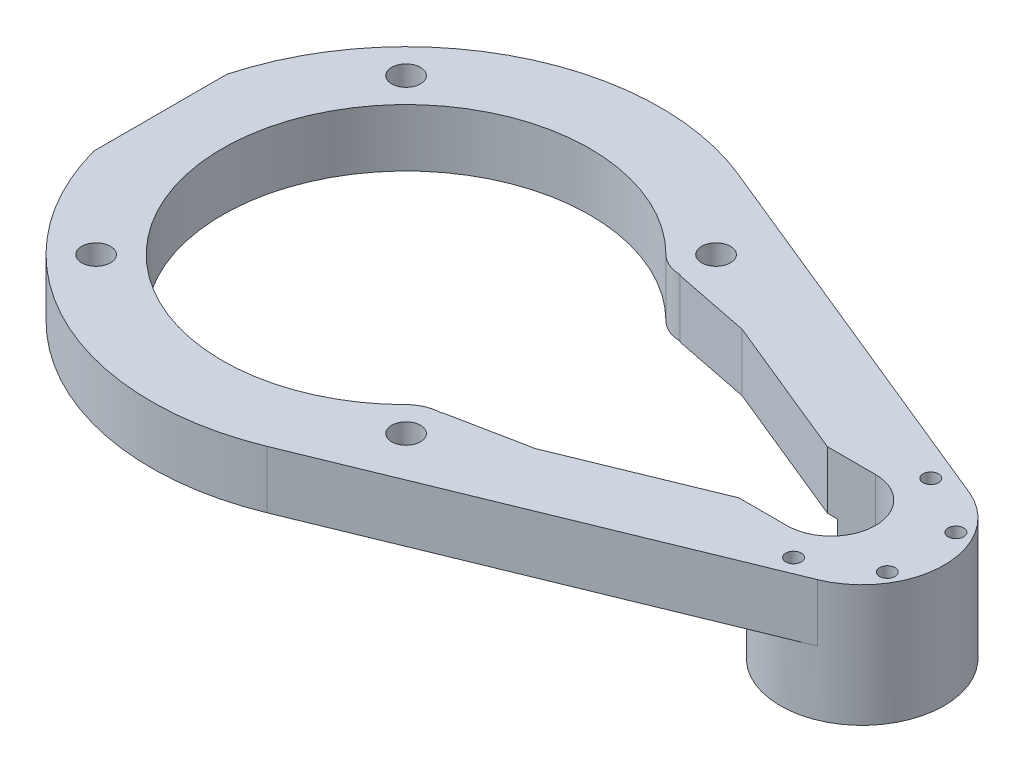
from build123d import *

# Parameters (mm, degrees)
SKETCH1_R           = 3.25
BOSS_EXTRUDE1_DEPTH = 13
BOSS_EXTRUDE2_START = -14.5
BOSS_EXTRUDE2_DEPTH = 14.5
CUT_EXTRUDE1_REACH  = 139.202
SKETCH3_R           = 1.75
SKETCH4_R           = 3.25
CUT_EXTRUDE2_DEPTH  = 1.2


with BuildPart() as part:
    # Sketch1 → Boss-Extrude1 (new body)
    with BuildSketch(Plane(origin=(0, 0, 0), x_dir=(1, 0, 0), z_dir=(0, 1, 0))):
        with BuildLine():
            ThreePointArc((21.76947877, 53.217002819), (-25.477840581, 51.544536415), (-55.5, 15.023634545))
            Line((-55.5, 15.023634545), (-55.5, -15.023634545))
            ThreePointArc((-55.5, -15.023634545), (-25.477840581, -51.544536415), (21.76947877, -53.217002819))
            Line((21.76947877, -53.217002819), (110.004400793, -17.122744217))
            ThreePointArc((110.004400793, -17.122744217), (121.5, 0), (110.004400793, 17.122744217))
            Line((110.004400793, 17.122744217), (21.76947877, 53.217002819))
        make_face()
        with Locations((-35, 35)):
            Circle(SKETCH1_R, mode=Mode.SUBTRACT)
        with BuildLine():
            ThreePointArc((29.343145829, 29.343145672), (31.938532593, 27.608963719), (35, 27))
            Line((35, 27), (35, 26.842197909))
            Line((35, 26.842197909), (52.547252782, 23.339790487))
            Line((52.547252782, 23.339790487), (85.157297123, 10))
            Line((85.157297123, 10), (96, 10))
            ThreePointArc((96, 10), (106, 0), (96, -10))
            Line((96, -10), (85.157297123, -10))
            Line((85.157297123, -10), (52.547252782, -23.339790487))
            Line((52.547252782, -23.339790487), (35, -26.842197909))
            Line((35, -26.842197909), (35, -27))
            ThreePointArc((35, -27), (31.938532454, -27.608963776), (29.343145617, -29.343145884))
            ThreePointArc((29.343145617, -29.343145884), (-41.497474683, 1.5e-07), (29.343145829, 29.343145672))
        make_face(mode=Mode.SUBTRACT)
        with Locations((35, 35)):
            Circle(SKETCH1_R, mode=Mode.SUBTRACT)
        with Locations((-35, -35)):
            Circle(SKETCH1_R, mode=Mode.SUBTRACT)
        with Locations((35, -35)):
            Circle(SKETCH1_R, mode=Mode.SUBTRACT)
    extrude(amount=BOSS_EXTRUDE1_DEPTH)

    # Sketch2 → Boss-Extrude2 (add)
    with BuildSketch(Plane(origin=(0, 0, 0), x_dir=(1, 0, 0), z_dir=(0, 1, 0)).offset(BOSS_EXTRUDE2_START)):
        with BuildLine():
            ThreePointArc((96, 10), (106, 0), (96, -10))
            Line((96, -10), (87.435617584, -10))
            ThreePointArc((87.435617584, -10), (108.210994401, -17.750930605), (121.5, 0))
            ThreePointArc((121.5, 0), (108.210994401, 17.750930605), (87.435617584, 10))
            Line((87.435617584, 10), (96, 10))
        make_face()
    extrude(amount=BOSS_EXTRUDE2_DEPTH)

    # Sketch3 → Cut-Extrude1 (cut, up to next)
    with BuildSketch(Plane.XZ.offset(14.5), mode=Mode.PRIVATE) as cut_extrude1_sk1:
        with Locations((103, 15.5)):
            Circle(SKETCH3_R)
    cut_extrude1_tool1 = extrude(cut_extrude1_sk1.sketch, amount=-CUT_EXTRUDE1_REACH, mode=Mode.PRIVATE) & part.part
    # Sketch3 → Cut-Extrude1 (cut, up to next)
    with BuildSketch(Plane.XZ.offset(14.5), mode=Mode.PRIVATE) as cut_extrude1_sk2:
        with Locations((116.423393759, 7.75)):
            Circle(SKETCH3_R)
    cut_extrude1_tool2 = extrude(cut_extrude1_sk2.sketch, amount=-CUT_EXTRUDE1_REACH, mode=Mode.PRIVATE) & part.part
    # Sketch3 → Cut-Extrude1 (cut, up to next)
    with BuildSketch(Plane.XZ.offset(14.5), mode=Mode.PRIVATE) as cut_extrude1_sk3:
        with Locations((116.423393759, -7.75)):
            Circle(SKETCH3_R)
    cut_extrude1_tool3 = extrude(cut_extrude1_sk3.sketch, amount=-CUT_EXTRUDE1_REACH, mode=Mode.PRIVATE) & part.part
    # Sketch3 → Cut-Extrude1 (cut, up to next)
    with BuildSketch(Plane.XZ.offset(14.5), mode=Mode.PRIVATE) as cut_extrude1_sk4:
        with Locations((103, -15.5)):
            Circle(SKETCH3_R)
    cut_extrude1_tool4 = extrude(cut_extrude1_sk4.sketch, amount=-CUT_EXTRUDE1_REACH, mode=Mode.PRIVATE) & part.part
    add(cut_extrude1_tool1.solids().sort_by_distance((103, -14.5, 15.5))[0], mode=Mode.SUBTRACT)
    add(cut_extrude1_tool2.solids().sort_by_distance((116.423394, -14.5, 7.75))[0], mode=Mode.SUBTRACT)
    add(cut_extrude1_tool3.solids().sort_by_distance((116.423394, -14.5, -7.75))[0], mode=Mode.SUBTRACT)
    add(cut_extrude1_tool4.solids().sort_by_distance((103, -14.5, -15.5))[0], mode=Mode.SUBTRACT)

    # Sketch4 → Cut-Extrude2 (cut)
    # profile 1 of 4: a face of its own
    with BuildSketch(Plane.XZ):
        Polygon((-33.430992924, 29.144385874), (-29.144385874, 33.430992924), (-30.71339295, 39.28660705), (-36.569007076, 40.855614126), (-40.855614126, 36.569007076), (-39.28660705, 30.71339295), align=None)
        with Locations((-35, 35)):
            Circle(SKETCH4_R, mode=Mode.SUBTRACT)
    # profile 2 of 4: a face of its own
    with BuildSketch(Plane.XZ):
        Polygon((33.430992924, 29.144385874), (39.28660705, 30.71339295), (40.855614126, 36.569007076), (36.569007076, 40.855614126), (30.71339295, 39.28660705), (29.144385874, 33.430992924), align=None)
        with Locations((35, 35)):
            Circle(SKETCH4_R, mode=Mode.SUBTRACT)
    # profile 3 of 4: a face of its own
    with BuildSketch(Plane.XZ):
        Polygon((-30.71339295, -39.28660705), (-29.144385874, -33.430992924), (-33.430992924, -29.144385874), (-39.28660705, -30.71339295), (-40.855614126, -36.569007076), (-36.569007076, -40.855614126), align=None)
        with Locations((-35, -35)):
            Circle(SKETCH4_R, mode=Mode.SUBTRACT)
    # profile 4 of 4: a face of its own
    with BuildSketch(Plane.XZ):
        Polygon((29.144385874, -33.430992924), (30.71339295, -39.28660705), (36.569007076, -40.855614126), (40.855614126, -36.569007076), (39.28660705, -30.71339295), (33.430992924, -29.144385874), align=None)
        with Locations((35, -35)):
            Circle(SKETCH4_R, mode=Mode.SUBTRACT)
    extrude(amount=-CUT_EXTRUDE2_DEPTH, mode=Mode.SUBTRACT)


solid = part.part
